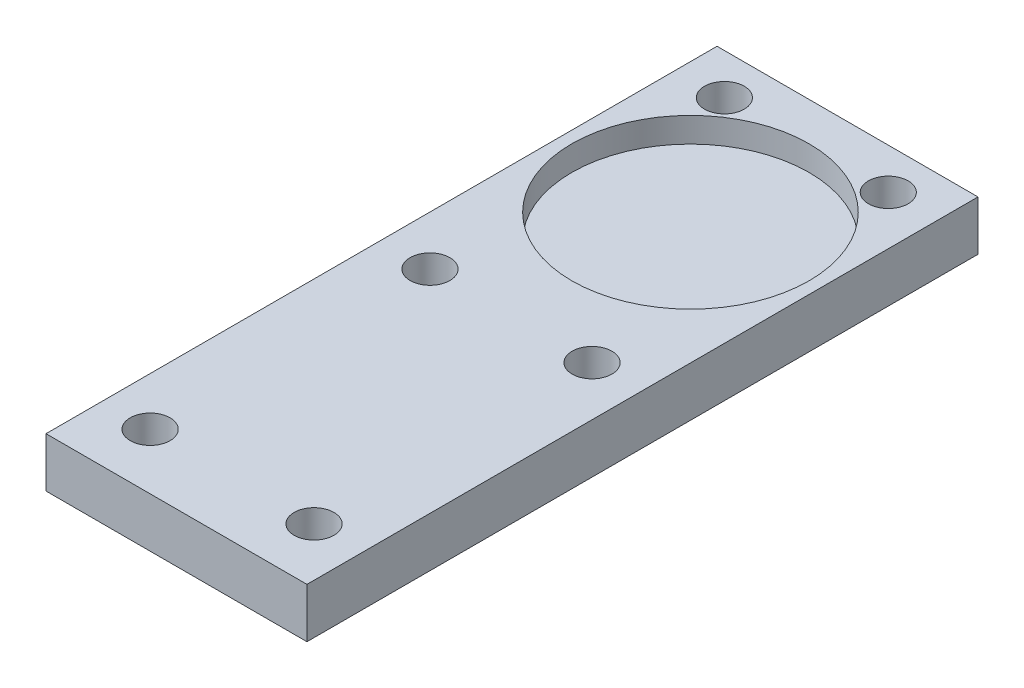
from build123d import *

# Parameters (mm, degrees)
BOSS_EXTRUDE1_DEPTH                             = 54
SKETCH3_R                                       = 9.55
CUT_EXTRUDE1_DEPTH                              = 2
CSK_FOR_M3_FLAT_HEAD_MACHINE_SCREW1_D           = 3.2
CSK_FOR_M3_FLAT_HEAD_MACHINE_SCREW1_DEPTH       = 5
CSK_FOR_M3_FLAT_HEAD_MACHINE_SCREW1_CSINK_D     = 6.3
CSK_FOR_M3_FLAT_HEAD_MACHINE_SCREW1_CSINK_ANGLE = 90
CSK_FOR_M3_FLAT_HEAD_MACHINE_SCREW1_TIP         = 0.96137699
SKETCH17_W                                      = 14.5
SKETCH17_H                                      = 17.9
CUT_EXTRUDE3_DEPTH                              = 63.008768846
CSK_FOR_M3_FLAT_HEAD_MACHINE_SCREW3_D           = 3.2
CSK_FOR_M3_FLAT_HEAD_MACHINE_SCREW3_DEPTH       = 5
CSK_FOR_M3_FLAT_HEAD_MACHINE_SCREW3_CSINK_D     = 6.3
CSK_FOR_M3_FLAT_HEAD_MACHINE_SCREW3_CSINK_ANGLE = 90
CSK_FOR_M3_FLAT_HEAD_MACHINE_SCREW3_TIP         = 0.96137699


with BuildPart() as part:
    # Sketch2 → Boss-Extrude1 (new body)
    with BuildSketch(Plane.XY):
        Polygon((8.909072716, 3), (8.909072716, -10.9), (-12.090927284, -10.9), (-12.090927284, 3), (-17.090927284, -10.9), (-26.590927284, -10.9), (-26.590927284, -14.9), (23.409072716, -14.9), (23.409072716, -10.9), (13.909072716, -10.9), align=None)
    extrude(amount=-BOSS_EXTRUDE1_DEPTH)

    # Sketch3 → Cut-Extrude1 (cut)
    with BuildSketch(Plane(origin=(0, -10.9, 0), x_dir=(1, 0, 0), z_dir=(0, 1, 0))):
        with Locations((-1.590927284, 41.36)):
            Circle(SKETCH3_R)
    extrude(amount=-CUT_EXTRUDE1_DEPTH, mode=Mode.SUBTRACT)

    # CSK for M3 Flat Head Machine Screw1
    with Locations(Plane(origin=(0, -14.9, 0), x_dir=(-1, 0, 0), z_dir=(0, -1, 0))):
        with Locations((8.110927284, 26.92), (-4.929072716, 26.92)):
            CounterSinkHole(CSK_FOR_M3_FLAT_HEAD_MACHINE_SCREW1_D / 2, CSK_FOR_M3_FLAT_HEAD_MACHINE_SCREW1_CSINK_D / 2, depth=CSK_FOR_M3_FLAT_HEAD_MACHINE_SCREW1_DEPTH, counter_sink_angle=CSK_FOR_M3_FLAT_HEAD_MACHINE_SCREW1_CSINK_ANGLE)
            with Locations((0, 0, -(CSK_FOR_M3_FLAT_HEAD_MACHINE_SCREW1_DEPTH + CSK_FOR_M3_FLAT_HEAD_MACHINE_SCREW1_TIP / 2))):  # 118° drill point
                Cone(0, CSK_FOR_M3_FLAT_HEAD_MACHINE_SCREW1_D / 2, CSK_FOR_M3_FLAT_HEAD_MACHINE_SCREW1_TIP, mode=Mode.SUBTRACT)

    # Sketch17 → Cut-Extrude3 (cut, through all)
    with BuildSketch(Plane.XY):
        with Locations((-19.340927284, -5.95)):
            Rectangle(SKETCH17_W, SKETCH17_H)
        with Locations((16.159072716, -5.95)):
            Rectangle(SKETCH17_W, SKETCH17_H)
    extrude(amount=-CUT_EXTRUDE3_DEPTH, mode=Mode.SUBTRACT)

    # CSK for M3 Flat Head Machine Screw3
    with Locations(Plane(origin=(0, -14.9, 0), x_dir=(-1, 0, 0), z_dir=(0, -1, 0))):
        with Locations((-4.978646835, 50.71), (8.210927284, 50.71), (8.210927284, 4.5), (-4.978646835, 4.5)):
            CounterSinkHole(CSK_FOR_M3_FLAT_HEAD_MACHINE_SCREW3_D / 2, CSK_FOR_M3_FLAT_HEAD_MACHINE_SCREW3_CSINK_D / 2, depth=CSK_FOR_M3_FLAT_HEAD_MACHINE_SCREW3_DEPTH, counter_sink_angle=CSK_FOR_M3_FLAT_HEAD_MACHINE_SCREW3_CSINK_ANGLE)
            with Locations((0, 0, -(CSK_FOR_M3_FLAT_HEAD_MACHINE_SCREW3_DEPTH + CSK_FOR_M3_FLAT_HEAD_MACHINE_SCREW3_TIP / 2))):  # 118° drill point
                Cone(0, CSK_FOR_M3_FLAT_HEAD_MACHINE_SCREW3_D / 2, CSK_FOR_M3_FLAT_HEAD_MACHINE_SCREW3_TIP, mode=Mode.SUBTRACT)


solid = part.part
